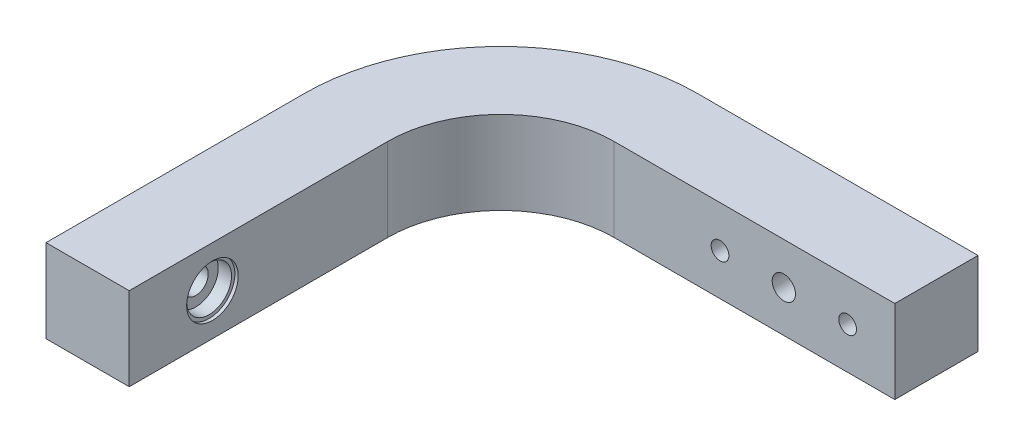
from build123d import *

# Parameters (mm, degrees)
BOSS_EXTRUDE1_DEPTH      = 7.5
BOSS_EXTRUDE1_DEPTH_BACK = 7.5
CUT_EXTRUDE1_DEPTH       = 109.725571969
CUT_EXTRUDE1_DEPTH_BACK  = 109.725571969
SKETCH2_R                = 2.25
SKETCH3_R                = 2.1
SKETCH3_R_2              = 1.6
CUT_EXTRUDE2_DEPTH       = 106.528432188


with BuildPart() as part:
    # Sketch1 → Boss-Extrude1 (new, two sides: drawn at the far end of the back side and taken through both)
    with BuildSketch(Plane(origin=(0, 0, 0), x_dir=(1, 0, 0), z_dir=(0, 1, 0)).offset(-BOSS_EXTRUDE1_DEPTH_BACK)):
        with BuildLine():
            Line((-66, -35.4), (-66, -82))
            Line((-66, -82), (-51, -82))
            Line((-51, -82), (-51, -35.4))
            ThreePointArc((-51, -35.4), (-45.024978336, -20.975021664), (-30.6, -15))
            Line((-30.6, -15), (20, -15))
            Line((20, -15), (20, 0))
            Line((20, 0), (-30.6, 0))
            ThreePointArc((-30.6, 0), (-55.631580054, -10.368419946), (-66, -35.4))
        make_face()
    extrude(amount=BOSS_EXTRUDE1_DEPTH + BOSS_EXTRUDE1_DEPTH_BACK)

    # Sketch2 → Cut-Extrude1 (cut, two sides: drawn at the far end of the back side and taken through both)
    with BuildSketch(Plane.ZY.offset(51).offset(-CUT_EXTRUDE1_DEPTH_BACK)):
        with Locations((67, 0)):
            Circle(SKETCH2_R)
    extrude(amount=CUT_EXTRUDE1_DEPTH + CUT_EXTRUDE1_DEPTH_BACK, mode=Mode.SUBTRACT)

    # Sketch3 → Cut-Extrude2 (cut, through all)
    with BuildSketch(Plane(origin=(0, 0, 0), x_dir=(-1, 0, 0), z_dir=(0, 0, -1))):
        Circle(SKETCH3_R)
        with Locations((-11.5, 0)):
            Circle(SKETCH3_R_2)
        with Locations((11.5, 0)):
            Circle(SKETCH3_R_2)
    extrude(amount=-CUT_EXTRUDE2_DEPTH, mode=Mode.SUBTRACT)

    # Sketch5 → bearing-seats (revolve, cut)
    with BuildSketch(Plane(origin=(0, 0, 0), x_dir=(1, 0, 0), z_dir=(0, 1, 0))):
        Polygon((-66, -71.65), (-65.4, -71.65), (-65.4, -71.05), (-63, -71.05), (-63, -67), (-66, -67), align=None)
        Polygon((-51, -67), (-54, -67), (-54, -71.05), (-51.6, -71.05), (-51.6, -71.65), (-51, -71.65), align=None)
    revolve(axis=Axis((-84.587759873, 0, 67), (1, 0, 0)), mode=Mode.SUBTRACT)


solid = part.part
